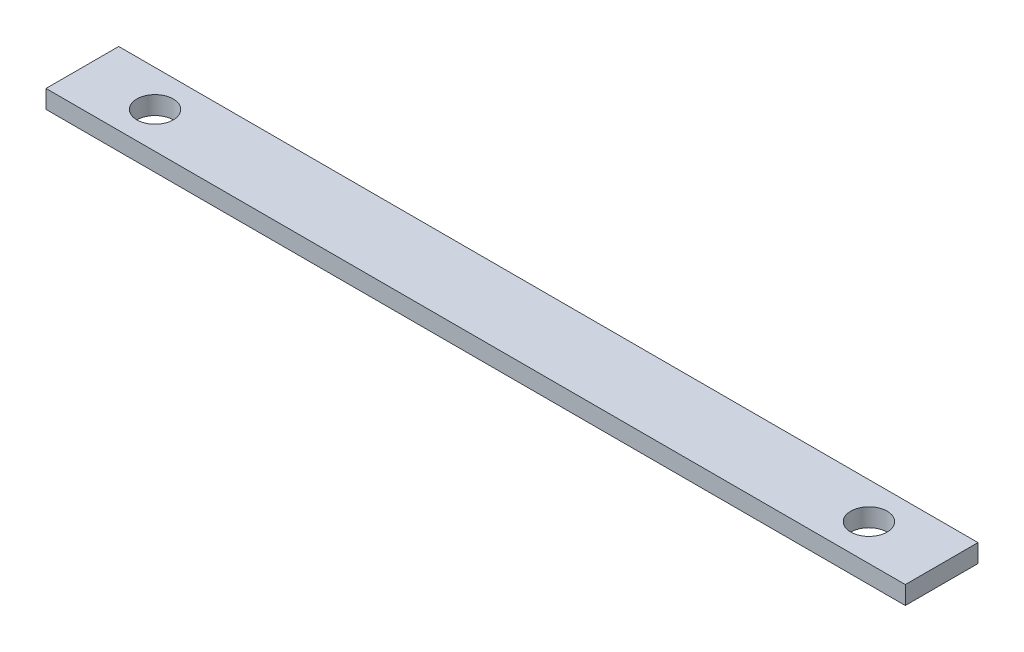
from build123d import *

# Parameters (mm, degrees)
SKETCH1_W           = 150.114
SKETCH1_H           = 12.7
BOSS_EXTRUDE1_DEPTH = 3.175
SKETCH2_R           = 3.175
CUT_EXTRUDE1_DEPTH  = 151.683720491


with BuildPart() as part:
    # Sketch1 → Boss-Extrude1 (new body)
    with BuildSketch(Plane(origin=(0, 0, 0), x_dir=(1, 0, 0), z_dir=(0, 1, 0))):
        with Locations((75.057, 6.35)):
            Rectangle(SKETCH1_W, SKETCH1_H)
    extrude(amount=BOSS_EXTRUDE1_DEPTH)

    # Sketch2 → Cut-Extrude1 (cut, through all)
    with BuildSketch(Plane(origin=(0, 3.175, 0), x_dir=(1, 0, 0), z_dir=(0, 1, 0))):
        with Locations((12.7, 6.35)):
            Circle(SKETCH2_R)
        with Locations((137.414, 6.35)):
            Circle(SKETCH2_R)
    extrude(amount=-CUT_EXTRUDE1_DEPTH, mode=Mode.SUBTRACT)


solid = part.part
